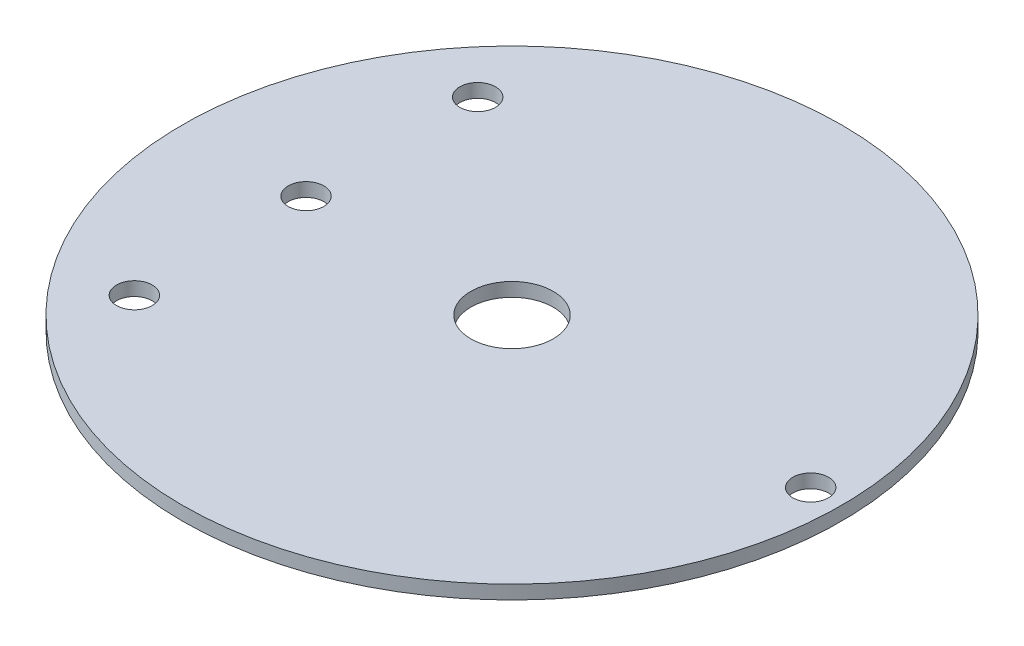
from build123d import *

# Parameters (mm, degrees)
SKETCH1_R           = 48
SKETCH1_R_2         = 2.6
SKETCH1_R_3         = 6
BOSS_EXTRUDE1_DEPTH = 2


with BuildPart() as part:
    # Sketch1 → Boss-Extrude1 (new body)
    with BuildSketch(Plane(origin=(0, 0, 0), x_dir=(1, 0, 0), z_dir=(0, 1, 0))):
        Circle(SKETCH1_R)
        with Locations((-30, 0)):
            Circle(SKETCH1_R_2, mode=Mode.SUBTRACT)
        Circle(SKETCH1_R_3, mode=Mode.SUBTRACT)
        with Locations((-30, 25)):
            Circle(SKETCH1_R_2, mode=Mode.SUBTRACT)
        with Locations((-30, -25)):
            Circle(SKETCH1_R_2, mode=Mode.SUBTRACT)
        with Locations((43.5, 0)):
            Circle(SKETCH1_R_2, mode=Mode.SUBTRACT)
    extrude(amount=BOSS_EXTRUDE1_DEPTH)


solid = part.part
